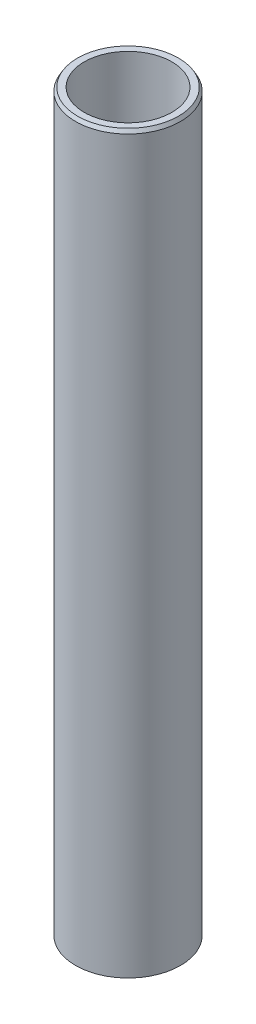
from build123d import *
from OCP.BRepFilletAPI import BRepFilletAPI_MakeChamfer

# Parameters (mm, degrees)
SKETCH1_R           = 37.5
BOSS_EXTRUDE1_DEPTH = 526.183527958
SKETCH2_R           = 31.305184533
CUT_EXTRUDE1_DEPTH  = 529.84932173
CHAMFER1_SIZE       = 2.543165176
CHAMFER1_SIZE2      = 1.468297099


with BuildPart() as part:
    # Sketch1 → Boss-Extrude1 (new body)
    with BuildSketch(Plane(origin=(0, 0, 0), x_dir=(1, 0, 0), z_dir=(0, 1, 0))):
        Circle(SKETCH1_R)
    extrude(amount=BOSS_EXTRUDE1_DEPTH)

    # Sketch2 → Cut-Extrude1 (cut, through all)
    with BuildSketch(Plane(origin=(0, 0, 0), x_dir=(1, 0, 0), z_dir=(0, 1, 0))):
        Circle(SKETCH2_R)
    extrude(amount=CUT_EXTRUDE1_DEPTH, mode=Mode.SUBTRACT)

    # Chamfer1: one chamfer whose edges measure the first distance from different faces: ONE call of the kernel's chamfer builder (chamfer() names one face for all edges)
    chamfer1_edges_1 = [part.edges().sort_by_distance(p)[0] for p in [
        (-37.5, 526.183527958, 0),
    ]]
    chamfer1_side_1 = [part.faces().sort_by_distance(p)[0] for p in [
        (-37.5, 263.091763979, 0),
    ]]
    chamfer1_edges_2 = [part.edges().sort_by_distance(p)[0] for p in [
        (-37.5, 0, 0),
    ]]
    chamfer1_side_2 = [part.faces().sort_by_distance(p)[0] for p in [
        (-36.439339828, 0, 0),
    ]]
    chamfer1 = BRepFilletAPI_MakeChamfer(part.part.solid().wrapped)
    for e in chamfer1_edges_1:
        chamfer1.Add(CHAMFER1_SIZE, CHAMFER1_SIZE2, e.wrapped, chamfer1_side_1[0].wrapped)  # the first distance lies on this face
    for e in chamfer1_edges_2:
        chamfer1.Add(CHAMFER1_SIZE, CHAMFER1_SIZE2, e.wrapped, chamfer1_side_2[0].wrapped)  # the first distance lies on this face
    add(Compound.cast(chamfer1.Shape()), mode=Mode.REPLACE)


solid = part.part
